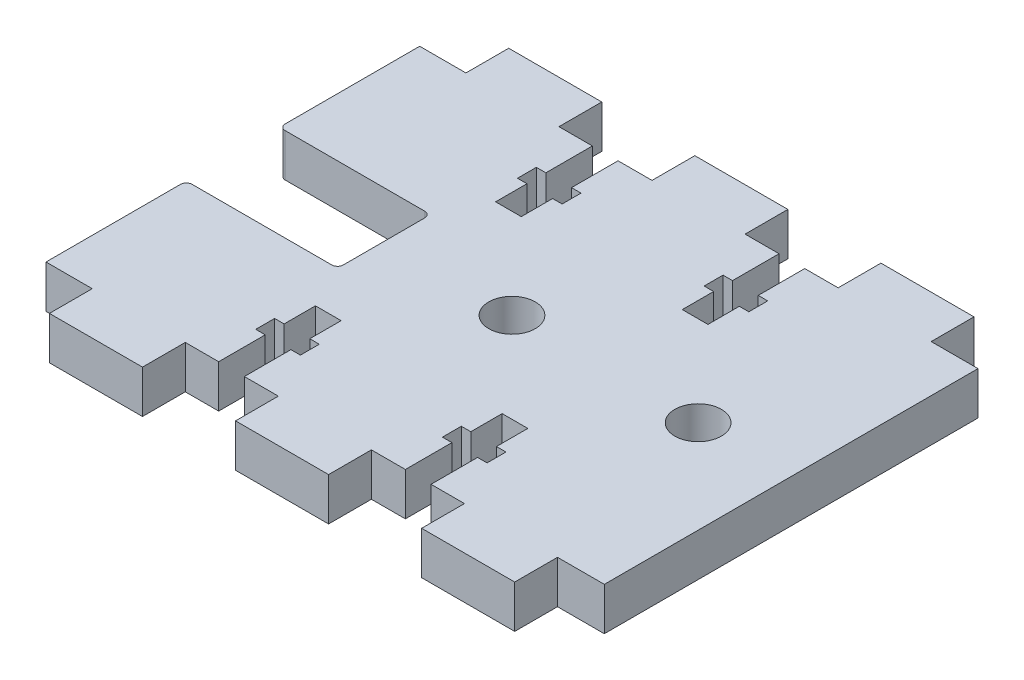
from build123d import *

# Parameters (mm, degrees)
BOSS_EXTRUDE1_DEPTH = 5.842
SKETCH2_R           = 3.175
CUT_EXTRUDE1_DEPTH  = 50.679572542
SKETCH3_W           = 25.4
SKETCH3_H           = 12.7
CUT_EXTRUDE2_DEPTH  = 50.679572542
FILLET1_R           = 0.79375


with BuildPart() as part:
    # Sketch1 → Boss-Extrude1 (new body)
    with BuildSketch(Plane(origin=(0, 0, 0), x_dir=(1, 0, 0), z_dir=(0, 1, 0))):
        Polygon((38.1, -25.5), (31.710404082, -25.5), (31.710404082, -31.342), (19.010404082, -31.342), (19.010404082, -25.5), (14.4526, -25.5), (14.4526, -19.15), (15.748, -19.15), (15.748, -16.571875), (14.4526, -16.571875), (14.4526, -12.291999784), (10.9474, -12.291999784), (10.9474, -16.571875), (9.652, -16.571875), (9.652, -19.15), (10.9474, -19.15), (10.9474, -25.5), (6.310404082, -25.5), (6.310404082, -31.342), (-6.389595918, -31.342), (-6.389595918, -25.5), (-11.026591835, -25.5), (-11.026591835, -19.15), (-9.731191835, -19.15), (-9.731191835, -16.571875), (-11.026591835, -16.571875), (-11.026591835, -12.291999784), (-14.531791835, -12.291999784), (-14.531791835, -16.571875), (-15.827191835, -16.571875), (-15.827191835, -19.15), (-14.531791835, -19.15), (-14.531791835, -25.5), (-19.089595918, -25.5), (-19.089595918, -31.342), (-31.789595918, -31.342), (-31.789595918, -25.5), (-38.1, -25.5), (-38.1, 25.5), (-31.789595918, 25.5), (-31.789595918, 31.342), (-19.089595918, 31.342), (-19.089595918, 25.5), (-14.531791835, 25.5), (-14.531791835, 19.15), (-15.827191835, 19.15), (-15.827191835, 16.571875), (-14.531791835, 16.571875), (-14.531791835, 12.291999784), (-11.026591835, 12.291999784), (-11.026591835, 16.571875), (-9.731191835, 16.571875), (-9.731191835, 19.15), (-11.026591835, 19.15), (-11.026591835, 25.5), (-6.389595918, 25.5), (-6.389595918, 31.342), (6.310404082, 31.342), (6.310404082, 25.5), (10.9474, 25.5), (10.9474, 19.15), (9.652, 19.15), (9.652, 16.571875), (10.9474, 16.571875), (10.9474, 12.291999784), (14.4526, 12.291999784), (14.4526, 16.571875), (15.748, 16.571875), (15.748, 19.15), (14.4526, 19.15), (14.4526, 25.5), (19.010404082, 25.5), (19.010404082, 31.342), (31.710404082, 31.342), (31.710404082, 25.5), (38.1, 25.5), align=None)
    extrude(amount=BOSS_EXTRUDE1_DEPTH)

    # Sketch2 → Cut-Extrude1 (cut, through all)
    with BuildSketch(Plane(origin=(0, 5.842, 0), x_dir=(1, 0, 0), z_dir=(0, 1, 0))):
        Circle(SKETCH2_R)
        with Locations((25.4, 0)):
            Circle(SKETCH2_R)
        with Locations((-25.479191835, 0)):
            Circle(SKETCH2_R)
    extrude(amount=-CUT_EXTRUDE1_DEPTH, mode=Mode.SUBTRACT)

    # Sketch3 → Cut-Extrude2 (cut, through all)
    with BuildSketch(Plane(origin=(0, 5.842, 0), x_dir=(1, 0, 0), z_dir=(0, 1, 0))):
        with Locations((-30.1625, 0)):
            Rectangle(SKETCH3_W, SKETCH3_H)
    extrude(amount=-CUT_EXTRUDE2_DEPTH, mode=Mode.SUBTRACT)

    # Fillet1
    fillet1_edges = [part.edges().sort_by_distance(p)[0] for p in [
        (-38.1, 2.921, -6.35),
        (-38.1, 2.921, 6.35),
        (-17.4625, 2.921, 6.35),
        (-17.4625, 2.921, -6.35),
    ]]
    fillet(fillet1_edges, radius=FILLET1_R)


solid = part.part
